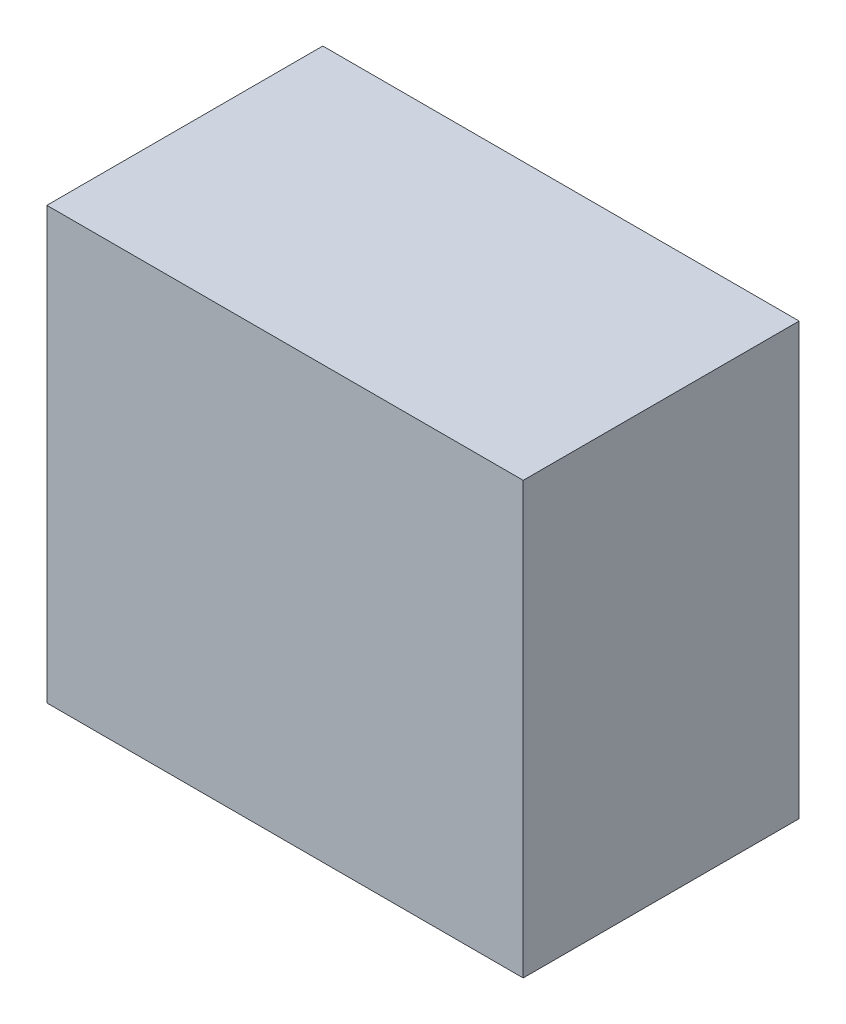
from build123d import *

# Parameters (mm, degrees)
SKETCH3_W                      = 21.924187445
SKETCH3_H                      = 19.837641971
BOSS_EXTRUDE1_DEPTH            = 6.35
SKETCH4_R                      = 3.175
CUT_EXTRUDE1_DEPTH             = 9.525
SKETCH5_R                      = 3.175
CUT_EXTRUDE5_DEPTH             = 9.525
CUT_EXTRUDE5_DIRECTION_2_REACH = 27.174
SKETCH6_R                      = 3.175
CUT_EXTRUDE6_DEPTH             = 9.525


with BuildPart() as part:
    # Sketch3 → Boss-Extrude1 (new, symmetric)
    with BuildSketch(Plane.XY):
        with Locations((10.962093723, -9.918820986)):
            Rectangle(SKETCH3_W, SKETCH3_H)
    extrude(amount=BOSS_EXTRUDE1_DEPTH, both=True)

    # Sketch4 → Cut-Extrude1 (cut)
    with BuildSketch(Plane.ZY):
        with Locations((0, -6.35)):
            Circle(SKETCH4_R)
    extrude(amount=-CUT_EXTRUDE1_DEPTH, mode=Mode.SUBTRACT)

    # Sketch5 → Cut-Extrude5 (cut)
    with BuildSketch(Plane(origin=(7.787093723, -19.837641971, 0), x_dir=(-0.8660254037844382, 0.500000000000001, 0), z_dir=(-0.500000000000001, -0.8660254037844382, 0))):
        Circle(SKETCH5_R)
    extrude(amount=-CUT_EXTRUDE5_DEPTH, mode=Mode.SUBTRACT)

    # Sketch5 → Cut-Extrude5 direction 2 (cut, up to next)
    with BuildSketch(Plane(origin=(7.787093723, -19.837641971, 0), x_dir=(-0.8660254037844382, 0.500000000000001, 0), z_dir=(-0.500000000000001, -0.8660254037844382, 0)), mode=Mode.PRIVATE) as cut_extrude5_direction_2_sk1:
        Circle(SKETCH5_R)
    cut_extrude5_direction_2_tool1 = extrude(cut_extrude5_direction_2_sk1.sketch, amount=CUT_EXTRUDE5_DIRECTION_2_REACH, mode=Mode.PRIVATE) & part.part
    add(cut_extrude5_direction_2_tool1.solids().sort_by_distance((7.787094, -19.837642, 0))[0], mode=Mode.SUBTRACT)

    # Sketch6 → Cut-Extrude6 (cut)
    with BuildSketch(Plane(origin=(0, 0, -6.35), x_dir=(-1, 0, 0), z_dir=(0, 0, -1))):
        with Locations((-15.574187445, -6.35)):
            Circle(SKETCH6_R)
    extrude(amount=-CUT_EXTRUDE6_DEPTH, mode=Mode.SUBTRACT)


solid = part.part
